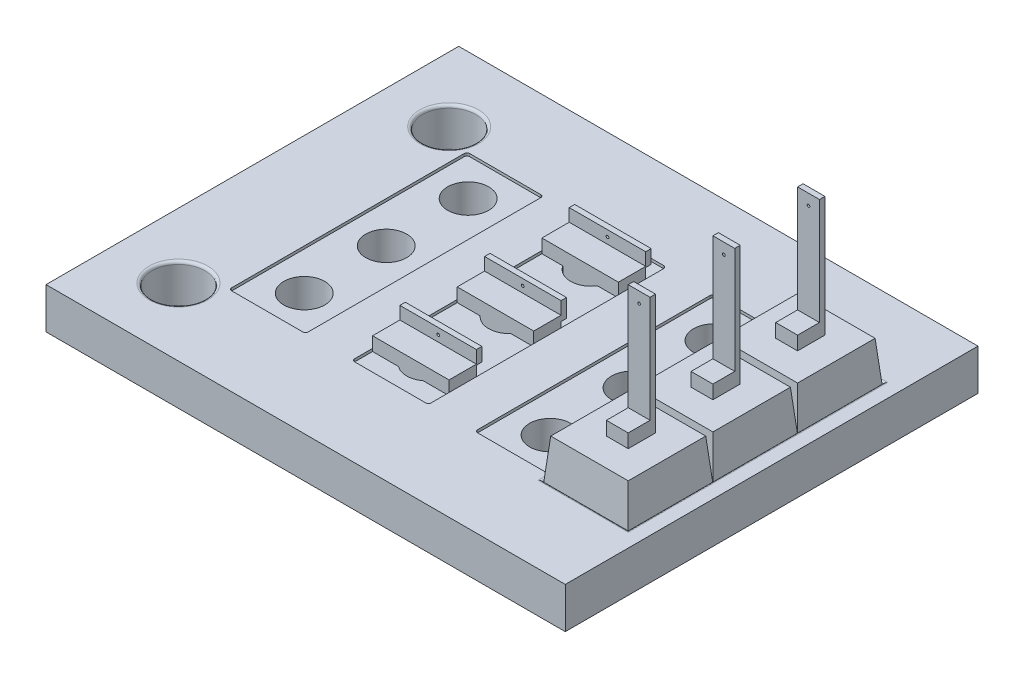
from build123d import *

# Parameters (mm, degrees)
SKETCH1_W             = 19.01
SKETCH1_H             = 15.11
BOSS_EXTRUDE1_DEPTH   = 1.5
SKETCH3_OUTSIDE_W     = 25.876
SKETCH3_OUTSIDE_H     = 21.976
SKETCH3_OUTSIDE_W_2   = 19.01
SKETCH3_OUTSIDE_H_2   = 15.11
SKETCH3_OUTSIDE_W_3   = 2.8
SKETCH3_OUTSIDE_H_3   = 8.71
CUT_EXTRUDE2_DEPTH    = 0.1
FILLET2_R             = 0.1
SKETCH4_R             = 0.75
CUT_EXTRUDE3_DEPTH    = 13.222235884
LPATTERN2_COUNT       = 2
LPATTERN2_PITCH       = 3
LPATTERN2_COL_COUNT   = 2
LPATTERN2_COL_PITCH   = 3
LPATTERN3_OUTLINE_R   = 0.75
LPATTERN3_DEPTH       = 1.5
LPATTERN3_START       = 1.4
LPATTERN3_2_OUTLINE_R = 0.75
LPATTERN3_2_DEPTH     = 0.1
SKETCH5_W             = 3.1
SKETCH5_H             = 9.3
CUT_EXTRUDE4_DEPTH    = 0.1
FILLET3_R             = 0.1
SKETCH7_W             = 3.1
SKETCH7_H             = 3.1
BOSS_EXTRUDE3_DEPTH   = 1.5
BOSS_EXTRUDE3_TAPER   = 5
BOSS_EXTRUDE4_START   = -4
SKETCH11_W            = 0.8
SKETCH11_H            = 0.8
BOSS_EXTRUDE4_DEPTH   = 4.5
SKETCH11_3_W          = 0.8
SKETCH11_3_H          = 0.2
BOSS_EXTRUDE5_DEPTH   = 4.4
SKETCH12_R            = 0.05
CUT_EXTRUDE6_DEPTH    = 0.2
LPATTERN4_COUNT       = 2
LPATTERN4_PITCH       = 3.1
LPATTERN4_COL_COUNT   = 2
LPATTERN4_COL_PITCH   = 3.1
BOSS_EXTRUDE6_START   = -2.5
SKETCH13_W            = 2.8
SKETCH13_H            = 1
BOSS_EXTRUDE6_DEPTH   = 3
SKETCH14_W            = 2.8
SKETCH14_H            = 0.164049169
BOSS_EXTRUDE7_DEPTH   = 0.2
SKETCH17_W            = 2.8
SKETCH17_H            = 0.2
BOSS_EXTRUDE8_DEPTH   = 0.5
SKETCH18_R            = 0.05
CUT_EXTRUDE7_DEPTH    = 0.2
LPATTERN5_COUNT       = 2
LPATTERN5_PITCH       = 3.1
LPATTERN5_COL_COUNT   = 2
LPATTERN5_COL_PITCH   = 3.1
SKETCH2_R             = 0.975
CUT_EXTRUDE1_DEPTH    = 14.455967078
FILLET1_R             = 0.1


# Read off the part's stored shape, not the designer's step: LPattern3
with BuildPart() as part:
    # Sketch1 → Boss-Extrude1 (new body)
    with BuildSketch(Plane(origin=(0, 0, 0), x_dir=(1, 0, 0), z_dir=(0, 1, 0))):
        Rectangle(SKETCH1_W, SKETCH1_H)
    extrude(amount=BOSS_EXTRUDE1_DEPTH)

    # Sketch3 outside → Cut-Extrude2 (cut)
    # profile 1 of 2: a face of its own
    with BuildSketch(Plane(origin=(0, 1.5, 0), x_dir=(1, 0, 0), z_dir=(0, 1, 0))):
        Rectangle(SKETCH3_OUTSIDE_W, SKETCH3_OUTSIDE_H)
        Rectangle(SKETCH3_OUTSIDE_W_2, SKETCH3_OUTSIDE_H_2, mode=Mode.SUBTRACT)
    # profile 2 of 2: a face of its own
    with BuildSketch(Plane(origin=(0, 1.5, 0), x_dir=(1, 0, 0), z_dir=(0, 1, 0))):
        with Locations((-4.605, 0)):
            Rectangle(SKETCH3_OUTSIDE_W_3, SKETCH3_OUTSIDE_H_3)
    extrude(amount=-CUT_EXTRUDE2_DEPTH, mode=Mode.SUBTRACT)

    # Fillet2
    fillet2_edges = [part.edges().sort_by_distance(p)[0] for p in [
        (-6.005, 1.45, 4.355),
        (-6.005, 1.45, -4.355),
        (-3.205, 1.45, -4.355),
        (-3.205, 1.45, 4.355),
    ]]
    fillet(fillet2_edges, radius=FILLET2_R)

    # Sketch4 → Cut-Extrude3 (cut, through all)
    with BuildSketch(Plane(origin=(0, 1.4, 0), x_dir=(1, 0, 0), z_dir=(0, 1, 0))):
        with Locations(Location((-4.605, 0, 0), (0, 0, 270))):
            Circle(SKETCH4_R)
    cut_extrude3 = extrude(amount=-CUT_EXTRUDE3_DEPTH, mode=Mode.SUBTRACT)

    # LPattern2: Cut-Extrude3 ×2
    with Locations(*[(0, 0, -i * LPATTERN2_PITCH) for i in range(1, LPATTERN2_COUNT)]):
        add(cut_extrude3, mode=Mode.SUBTRACT)

    # LPattern2 col: Cut-Extrude3 ×2
    with Locations(*[(0, 0, i * LPATTERN2_COL_PITCH) for i in range(1, LPATTERN2_COL_COUNT)]):
        add(cut_extrude3, mode=Mode.SUBTRACT)

    # LPattern3 outline → LPattern3 (cut)
    with BuildSketch(Plane(origin=(0, 0, 0), x_dir=(1, 0, 0), z_dir=(0, 1, 0))):
        with Locations((4.395, -3)):
            Circle(LPATTERN3_OUTLINE_R)
        with Locations((4.395, 3)):
            Circle(LPATTERN3_OUTLINE_R)
        with Locations((4.395, 0)):
            Circle(LPATTERN3_OUTLINE_R)
        with Locations((-0.105, -3)):
            Circle(LPATTERN3_OUTLINE_R)
        with Locations((-0.105, 3)):
            Circle(LPATTERN3_OUTLINE_R)
        with Locations((-0.105, 0)):
            Circle(LPATTERN3_OUTLINE_R)
    extrude(amount=LPATTERN3_DEPTH, mode=Mode.SUBTRACT)

    # LPattern3 2 outline → LPattern3 2 (cut)
    # profile 1 of 2: a face of its own
    with BuildSketch(Plane(origin=(0, 0, 0), x_dir=(1, 0, 0), z_dir=(0, 1, 0)).offset(LPATTERN3_START)):
        with BuildLine():
            Line((5.695, 4.355), (3.095, 4.355))
            ThreePointArc((3.095, 4.355), (3.024289322, 4.325710678), (2.995, 4.255))
            Line((2.995, 4.255), (2.995, -4.255))
            ThreePointArc((2.995, -4.255), (3.024289322, -4.325710678), (3.095, -4.355))
            Line((3.095, -4.355), (5.695, -4.355))
            ThreePointArc((5.695, -4.355), (5.765710678, -4.325710678), (5.795, -4.255))
            Line((5.795, -4.255), (5.795, 4.255))
            ThreePointArc((5.795, 4.255), (5.765710678, 4.325710678), (5.695, 4.355))
        make_face()
        with Locations((4.395, -3)):
            Circle(LPATTERN3_2_OUTLINE_R, mode=Mode.SUBTRACT)
        with Locations((4.395, 0)):
            Circle(LPATTERN3_2_OUTLINE_R, mode=Mode.SUBTRACT)
        with Locations((4.395, 3)):
            Circle(LPATTERN3_2_OUTLINE_R, mode=Mode.SUBTRACT)
    # profile 2 of 2: a face of its own
    with BuildSketch(Plane(origin=(0, 0, 0), x_dir=(1, 0, 0), z_dir=(0, 1, 0)).offset(LPATTERN3_START)):
        with BuildLine():
            Line((1.195, 4.355), (-1.405, 4.355))
            ThreePointArc((-1.405, 4.355), (-1.475710678, 4.325710678), (-1.505, 4.255))
            Line((-1.505, 4.255), (-1.505, -4.255))
            ThreePointArc((-1.505, -4.255), (-1.475710678, -4.325710678), (-1.405, -4.355))
            Line((-1.405, -4.355), (1.195, -4.355))
            ThreePointArc((1.195, -4.355), (1.265710678, -4.325710678), (1.295, -4.255))
            Line((1.295, -4.255), (1.295, 4.255))
            ThreePointArc((1.295, 4.255), (1.265710678, 4.325710678), (1.195, 4.355))
        make_face()
        with Locations((-0.105, -3)):
            Circle(LPATTERN3_2_OUTLINE_R, mode=Mode.SUBTRACT)
        with Locations((-0.105, 0)):
            Circle(LPATTERN3_2_OUTLINE_R, mode=Mode.SUBTRACT)
        with Locations((-0.105, 3)):
            Circle(LPATTERN3_2_OUTLINE_R, mode=Mode.SUBTRACT)
    extrude(amount=LPATTERN3_2_DEPTH, mode=Mode.SUBTRACT)

    # Sketch5 → Cut-Extrude4 (cut)
    with BuildSketch(Plane(origin=(0, 1.5, 0), x_dir=(1, 0, 0), z_dir=(0, 1, 0))):
        with Locations((7.355, 0)):
            Rectangle(SKETCH5_W, SKETCH5_H)
    extrude(amount=-CUT_EXTRUDE4_DEPTH, mode=Mode.SUBTRACT)

    # Fillet3
    # the kernel refuses this fillet: 0.1 mm, written as the material it takes off along each edge
    with BuildSketch(Plane(origin=(5.805, 1.5, 4.65), x_dir=(0, 0, 1), z_dir=(1, 0, 0)), Plane(origin=(8.905, 1.5, -4.65), x_dir=(0, 0, -1), z_dir=(-1, 0, 0))) as fillet3_piece_1:
        with BuildLine():
            CenterArc((FILLET3_R, FILLET3_R), FILLET3_R, 180, 90)
            Line((0, FILLET3_R), (0, 0))
            Line((0, 0), (FILLET3_R, 0))
        make_face()
    extrude(amount=3.1, mode=Mode.SUBTRACT)
    with BuildSketch(Plane(origin=(8.905, 1.5, 4.65), x_dir=(1, 0, 0), z_dir=(0, 0, -1)), Plane(origin=(5.805, 1.5, -4.65), x_dir=(-1, 0, 0), z_dir=(0, 0, 1))) as fillet3_piece_2:
        with BuildLine():
            CenterArc((FILLET3_R, FILLET3_R), FILLET3_R, 180, 90)
            Line((0, FILLET3_R), (0, 0))
            Line((0, 0), (FILLET3_R, 0))
        make_face()
    extrude(amount=9.3, mode=Mode.SUBTRACT)
    with BuildSketch(Plane(origin=(5.805, 1.5, -4.65), x_dir=(-1, 0, 0), z_dir=(0, 0, 1))) as fillet3_piece_3a_section:
        with BuildLine():
            CenterArc((FILLET3_R, FILLET3_R), FILLET3_R, 180, 90)
            Line((0, FILLET3_R), (0, 0))
            Line((0, 0), (FILLET3_R, 0))
        make_face()
    fillet3_piece_3a = extrude(amount=9.55, mode=Mode.PRIVATE)
    fillet3_piece_3a = split(fillet3_piece_3a, bisect_by=Plane(origin=(5.782360489, 1.477360489, 4.65), z_dir=(0, 0, 1)), keep=Keep.TOP, mode=Mode.PRIVATE)
    with BuildSketch(Plane(origin=(5.555, 1.5, 4.65), x_dir=(0, 0, 1), z_dir=(1, 0, 0))) as fillet3_piece_3b_section:
        with BuildLine():
            CenterArc((FILLET3_R, FILLET3_R), FILLET3_R, 180, 90)
            Line((0, FILLET3_R), (0, 0))
            Line((0, 0), (FILLET3_R, 0))
        make_face()
    fillet3_piece_3b = extrude(amount=3.35, mode=Mode.PRIVATE)
    fillet3_piece_3b = split(fillet3_piece_3b, bisect_by=Plane(origin=(5.805, 1.477360489, 4.672639511), z_dir=(-1, 0, 0)), keep=Keep.TOP, mode=Mode.PRIVATE)
    fillet3_piece_3 = fillet3_piece_3a & fillet3_piece_3b
    add(fillet3_piece_3, mode=Mode.SUBTRACT)
    with BuildSketch(Plane(origin=(5.805, 1.5, 4.65), x_dir=(0, 0, 1), z_dir=(1, 0, 0))) as fillet3_piece_4a_section:
        with BuildLine():
            CenterArc((FILLET3_R, FILLET3_R), FILLET3_R, 180, 90)
            Line((0, FILLET3_R), (0, 0))
            Line((0, 0), (FILLET3_R, 0))
        make_face()
    fillet3_piece_4a = extrude(amount=3.35, mode=Mode.PRIVATE)
    fillet3_piece_4a = split(fillet3_piece_4a, bisect_by=Plane(origin=(8.905, 1.477360489, 4.672639511), z_dir=(1, 0, 0)), keep=Keep.TOP, mode=Mode.PRIVATE)
    with BuildSketch(Plane(origin=(8.905, 1.5, 4.9), x_dir=(1, 0, 0), z_dir=(0, 0, -1))) as fillet3_piece_4b_section:
        with BuildLine():
            CenterArc((FILLET3_R, FILLET3_R), FILLET3_R, 180, 90)
            Line((0, FILLET3_R), (0, 0))
            Line((0, 0), (FILLET3_R, 0))
        make_face()
    fillet3_piece_4b = extrude(amount=9.55, mode=Mode.PRIVATE)
    fillet3_piece_4b = split(fillet3_piece_4b, bisect_by=Plane(origin=(8.927639511, 1.477360489, 4.65), z_dir=(0, 0, 1)), keep=Keep.TOP, mode=Mode.PRIVATE)
    fillet3_piece_4 = fillet3_piece_4a & fillet3_piece_4b
    add(fillet3_piece_4, mode=Mode.SUBTRACT)
    with BuildSketch(Plane(origin=(9.155, 1.5, -4.65), x_dir=(0, 0, -1), z_dir=(-1, 0, 0))) as fillet3_piece_5a_section:
        with BuildLine():
            CenterArc((FILLET3_R, FILLET3_R), FILLET3_R, 180, 90)
            Line((0, FILLET3_R), (0, 0))
            Line((0, 0), (FILLET3_R, 0))
        make_face()
    fillet3_piece_5a = extrude(amount=3.35, mode=Mode.PRIVATE)
    fillet3_piece_5a = split(fillet3_piece_5a, bisect_by=Plane(origin=(8.905, 1.477360489, -4.672639511), z_dir=(1, 0, 0)), keep=Keep.TOP, mode=Mode.PRIVATE)
    with BuildSketch(Plane(origin=(8.905, 1.5, 4.65), x_dir=(1, 0, 0), z_dir=(0, 0, -1))) as fillet3_piece_5b_section:
        with BuildLine():
            CenterArc((FILLET3_R, FILLET3_R), FILLET3_R, 180, 90)
            Line((0, FILLET3_R), (0, 0))
            Line((0, 0), (FILLET3_R, 0))
        make_face()
    fillet3_piece_5b = extrude(amount=9.55, mode=Mode.PRIVATE)
    fillet3_piece_5b = split(fillet3_piece_5b, bisect_by=Plane(origin=(8.927639511, 1.477360489, -4.65), z_dir=(0, 0, -1)), keep=Keep.TOP, mode=Mode.PRIVATE)
    fillet3_piece_5 = fillet3_piece_5a & fillet3_piece_5b
    add(fillet3_piece_5, mode=Mode.SUBTRACT)
    with BuildSketch(Plane(origin=(8.905, 1.5, -4.65), x_dir=(0, 0, -1), z_dir=(-1, 0, 0))) as fillet3_piece_6a_section:
        with BuildLine():
            CenterArc((FILLET3_R, FILLET3_R), FILLET3_R, 180, 90)
            Line((0, FILLET3_R), (0, 0))
            Line((0, 0), (FILLET3_R, 0))
        make_face()
    fillet3_piece_6a = extrude(amount=3.35, mode=Mode.PRIVATE)
    fillet3_piece_6a = split(fillet3_piece_6a, bisect_by=Plane(origin=(5.805, 1.477360489, -4.672639511), z_dir=(-1, 0, 0)), keep=Keep.TOP, mode=Mode.PRIVATE)
    with BuildSketch(Plane(origin=(5.805, 1.5, -4.9), x_dir=(-1, 0, 0), z_dir=(0, 0, 1))) as fillet3_piece_6b_section:
        with BuildLine():
            CenterArc((FILLET3_R, FILLET3_R), FILLET3_R, 180, 90)
            Line((0, FILLET3_R), (0, 0))
            Line((0, 0), (FILLET3_R, 0))
        make_face()
    fillet3_piece_6b = extrude(amount=9.55, mode=Mode.PRIVATE)
    fillet3_piece_6b = split(fillet3_piece_6b, bisect_by=Plane(origin=(5.782360489, 1.477360489, -4.65), z_dir=(0, 0, -1)), keep=Keep.TOP, mode=Mode.PRIVATE)
    fillet3_piece_6 = fillet3_piece_6a & fillet3_piece_6b
    add(fillet3_piece_6, mode=Mode.SUBTRACT)

    # Sketch7 → Boss-Extrude3 (add)
    with BuildSketch(Plane(origin=(0, 1.4, 0), x_dir=(1, 0, 0), z_dir=(0, 1, 0))):
        with Locations((7.355, 0)):
            Rectangle(SKETCH7_W, SKETCH7_H)
    boss_extrude3 = extrude(amount=BOSS_EXTRUDE3_DEPTH, taper=BOSS_EXTRUDE3_TAPER)

    # Sketch11 → Boss-Extrude4 (add)
    with BuildSketch(Plane(origin=(0, 2.9, 0), x_dir=(1, 0, 0), z_dir=(0, 1, 0)).offset(BOSS_EXTRUDE4_START)):
        with Locations((7.355, 0)):
            Rectangle(SKETCH11_W, SKETCH11_H)
    boss_extrude4 = extrude(amount=BOSS_EXTRUDE4_DEPTH)

    # Sketch11<3> → Boss-Extrude5 (add)
    with BuildSketch(Plane(origin=(0, 2.9, 0), x_dir=(1, 0, 0), z_dir=(0, 1, 0))):
        with Locations((7.355, 0.5)):
            Rectangle(SKETCH11_3_W, SKETCH11_3_H)
    boss_extrude5 = extrude(amount=BOSS_EXTRUDE5_DEPTH)

    # Sketch12 → Cut-Extrude6 (cut)
    with BuildSketch(Plane.XY.offset(-0.4)):
        with Locations((7.355, 6.9)):
            Circle(SKETCH12_R)
    cut_extrude6 = extrude(amount=-CUT_EXTRUDE6_DEPTH, mode=Mode.SUBTRACT)

    # LPattern4: Boss-Extrude3, Boss-Extrude4, Boss-Extrude5, Cut-Extrude6 ×2
    with Locations(*[(0, 0, -i * LPATTERN4_PITCH) for i in range(1, LPATTERN4_COUNT)]):
        add(boss_extrude3)
        add(boss_extrude4)
        add(boss_extrude5)
        add(cut_extrude6, mode=Mode.SUBTRACT)

    # LPattern4 col: Boss-Extrude3, Boss-Extrude4, Boss-Extrude5, Cut-Extrude6 ×2
    with Locations(*[(0, 0, i * LPATTERN4_COL_PITCH) for i in range(1, LPATTERN4_COL_COUNT)]):
        add(boss_extrude3)
        add(boss_extrude4)
        add(boss_extrude5)
        add(cut_extrude6, mode=Mode.SUBTRACT)

    # Sketch13 → Boss-Extrude6 (add)
    with BuildSketch(Plane(origin=(0, 1.4, 0), x_dir=(1, 0, 0), z_dir=(0, 1, 0)).offset(BOSS_EXTRUDE6_START)):
        with Locations((-0.105, 0)):
            Rectangle(SKETCH13_W, SKETCH13_H)
    boss_extrude6 = extrude(amount=BOSS_EXTRUDE6_DEPTH)

    # Sketch14 → Boss-Extrude7 (add)
    with BuildSketch(Plane(origin=(0, 0, -0.5), x_dir=(-1, 0, 0), z_dir=(0, 0, -1))):
        with Locations((0.105, 1.782024585)):
            Rectangle(SKETCH14_W, SKETCH14_H)
    extrude(amount=BOSS_EXTRUDE7_DEPTH)

    # Sketch17 → Boss-Extrude8 (add)
    with BuildSketch(Plane(origin=(0, 1.864049169, 0), x_dir=(1, 0, 0), z_dir=(0, 1, 0))):
        with Locations((-0.105, 0.6)):
            Rectangle(SKETCH17_W, SKETCH17_H)
    boss_extrude8 = extrude(amount=BOSS_EXTRUDE8_DEPTH)

    # Sketch18 → Cut-Extrude7 (cut)
    with BuildSketch(Plane.XY.offset(-0.5)):
        with Locations((-0.105, 2.132024585)):
            Circle(SKETCH18_R)
    cut_extrude7 = extrude(amount=-CUT_EXTRUDE7_DEPTH, mode=Mode.SUBTRACT)

    # LPattern5: Boss-Extrude6, Boss-Extrude8, Cut-Extrude7 ×2
    with Locations(*[(0, 0, -i * LPATTERN5_PITCH) for i in range(1, LPATTERN5_COUNT)]):
        add(boss_extrude6)
        add(boss_extrude8)
        add(cut_extrude7, mode=Mode.SUBTRACT)

    # LPattern5 col: Boss-Extrude6, Boss-Extrude8, Cut-Extrude7 ×2
    with Locations(*[(0, 0, i * LPATTERN5_COL_PITCH) for i in range(1, LPATTERN5_COL_COUNT)]):
        add(boss_extrude6)
        add(boss_extrude8)
        add(cut_extrude7, mode=Mode.SUBTRACT)

    # Sketch2 → Cut-Extrude1 (cut, through all)
    with BuildSketch(Plane(origin=(0, 1.5, 0), x_dir=(1, 0, 0), z_dir=(0, 1, 0))):
        with Locations(Location((-7.13, -5.08, 0), (0, 0, 270))):
            Circle(SKETCH2_R)
        with Locations(Location((-7.13, 4.83, 0), (0, 0, 270))):
            Circle(SKETCH2_R)
    extrude(amount=-CUT_EXTRUDE1_DEPTH, mode=Mode.SUBTRACT)

    # Fillet1
    fillet1_edges = [part.edges().sort_by_distance(p)[0] for p in [
        (-7.13, 0, 4.105),
        (-7.13, 1.5, 4.105),
        (-7.13, 0, -5.805),
        (-7.13, 1.5, -5.805),
    ]]
    fillet(fillet1_edges, radius=FILLET1_R)


solid = part.part
